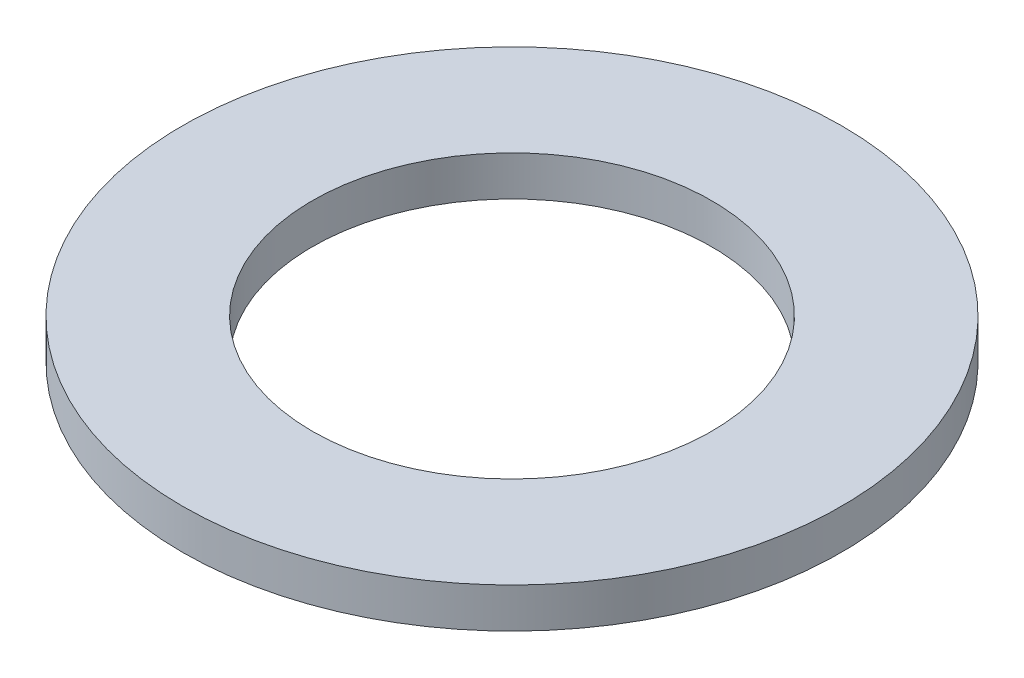
from build123d import *

# Parameters (mm, degrees)
SKETCH1_R           = 82.5
BOSS_EXTRUDE1_DEPTH = 10
SKETCH2_R           = 50
CUT_EXTRUDE1_DEPTH  = 118.100384286


with BuildPart() as part:
    # Sketch1 → Boss-Extrude1 (new body)
    with BuildSketch(Plane(origin=(0, 0, 0), x_dir=(1, 0, 0), z_dir=(0, 1, 0))):
        Circle(SKETCH1_R)
    extrude(amount=BOSS_EXTRUDE1_DEPTH)

    # Sketch2 → Cut-Extrude1 (cut, through all)
    with BuildSketch(Plane(origin=(0, 0, 0), x_dir=(1, 0, 0), z_dir=(0, 1, 0))):
        Circle(SKETCH2_R)
    extrude(amount=CUT_EXTRUDE1_DEPTH, mode=Mode.SUBTRACT)


solid = part.part
